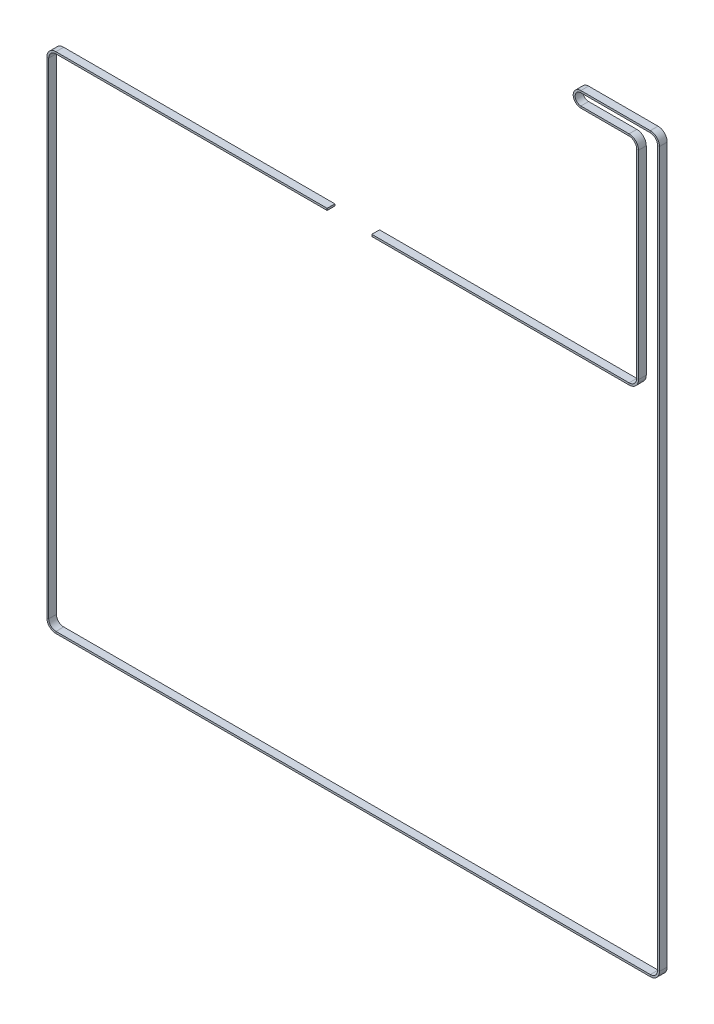
from build123d import *

# Parameters (mm, degrees)
SKETCH4_W = 6
SKETCH4_H = 1.5


with BuildPart() as part:
    # Sweep1: sweep along a path in Sketch1
    with BuildLine(Plane.XY.offset(2.2)) as sweep1_path:
        Line((180.113317989, -320.153964702), (-30.687774041, -320.153964702))
        ThreePointArc((-30.687774041, -320.153964702), (-35.195579771, -322.021158972), (-37.062774041, -326.528964702))
        Line((-37.062774041, -326.528964702), (-37.062774041, -703.985411885))
        ThreePointArc((-37.062774041, -703.985411885), (-35.195579771, -708.493217615), (-30.687774041, -710.360411885))
        Line((-30.687774041, -710.360411885), (431.312225959, -710.360411885))
        ThreePointArc((431.312225959, -710.360411885), (435.820031689, -708.493217615), (437.687225959, -703.985411885))
        Line((437.687225959, -703.985411885), (437.687225959, -148.660411885))
        ThreePointArc((437.687225959, -148.660411885), (435.820031689, -144.152606155), (431.312225959, -142.285411885))
        Line((431.312225959, -142.285411885), (377.312225959, -142.285411885))
        ThreePointArc((377.312225959, -142.285411885), (372.112225959, -147.485411885), (377.312225959, -152.685411885))
        Line((377.312225959, -152.685411885), (414.812225959, -152.685411885))
        ThreePointArc((414.812225959, -152.685411885), (419.479130714, -154.618507129), (421.412225959, -159.285411885))
        Line((421.412225959, -159.285411885), (421.412225959, -313.703964702))
        ThreePointArc((421.412225959, -313.703964702), (419.479130714, -318.370869458), (414.812225959, -320.303964702))
        Line((414.812225959, -320.303964702), (214.813317989, -320.303964702))
    # Sketch4 → Sweep1 (sweep)
    with BuildSketch(Plane(origin=(180.113317989, -320.153964702, 2.2), x_dir=(0, 0, -1), z_dir=(1, 0, 0))):
        Rectangle(SKETCH4_W, SKETCH4_H)
    sweep(path=sweep1_path.line)


solid = part.part
